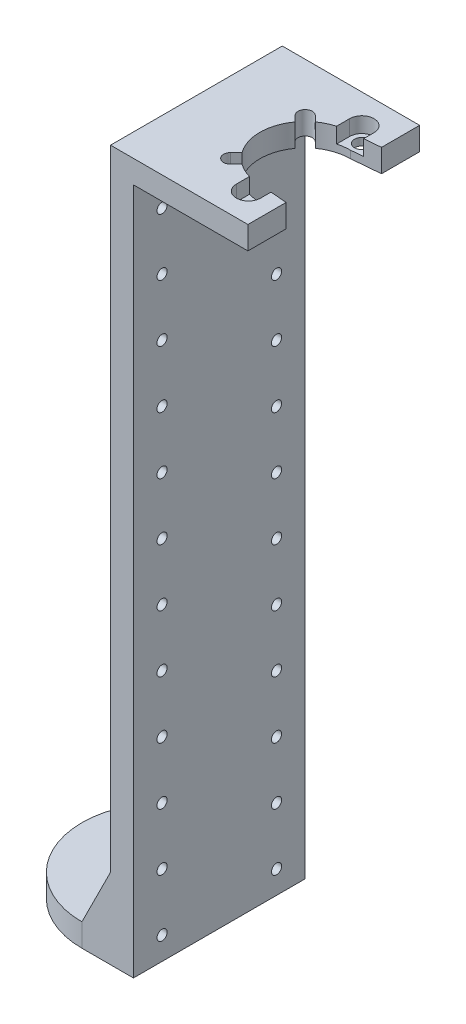
from build123d import *

# Parameters (mm, degrees)
BRACKETMAINBODY_DEPTH         = 15
CUTEXTRUDE_SQUIDCUTOUTS_START = 120
SQUIDCUTOUTS_R                = 1.3
CUTEXTRUDE_SQUIDCUTOUTS_DEPTH = 244.292335528
M4_CLEARANCE_HOLE1_D          = 4.5
CUT_EXTRUDE12_REACH           = 129.189
FILLET11_R                    = 15
FILLET12_R                    = 15
F_2_56_TAPPED_HOLE1_D         = 1.778
LPATTERN3_OUTLINE_R           = 0.889
LPATTERN3_DEPTH               = 4
CUT_EXTRUDE14_START           = -2.7
CUT_EXTRUDE14_OUTLINE_R       = 1.3
CUT_EXTRUDE14_DEPTH           = 2.7
BOSS_EXTRUDE3_DEPTH           = 2
BOSS_EXTRUDE4_DEPTH           = 2
FILLET17_R                    = 3.5
FILLET18_R                    = 3.5


# Read off the part's stored shape, not the designer's step: LPattern3, Cut-Extrude14
# Some blends are built 0.0001 mm under size
with BuildPart() as part:
    # Sketch1 → BracketMainBody (new, symmetric)
    with BuildSketch(Plane.XY):
        Polygon((0, 0), (0, 120), (24, 120), (24, 116), (4, 116), (4, -4), (-20, -4), (-20, 0), align=None)
    extrude(amount=BRACKETMAINBODY_DEPTH, both=True)

    # SQUIDcutouts → CutExtrude_SQUIDcutouts (cut, through all)
    with BuildSketch(Plane(origin=(0, 0, 0), x_dir=(1, 0, 0), z_dir=(0, 1, 0)).offset(CUTEXTRUDE_SQUIDCUTOUTS_START)):
        with Locations(Location((19, -9.9, 0), (0, 0, 270))):
            Circle(SQUIDCUTOUTS_R)
        with Locations(Location((19, 9.9, 0), (0, 0, 270))):
            Circle(SQUIDCUTOUTS_R)
        with BuildLine():
            Line((12.600343686, 4.631889361), (11.616116524, 5.616116524))
            ThreePointArc((11.616116524, 5.616116524), (11.616116524, 7.383883476), (13.383883476, 7.383883476))
            Line((13.383883476, 7.383883476), (14.368110639, 6.399656314))
            ThreePointArc((14.368110639, 6.399656314), (26.9, 0), (14.368110639, -6.399656314))
            Line((14.368110639, -6.399656314), (13.383883476, -7.383883476))
            ThreePointArc((13.383883476, -7.383883476), (11.616116524, -7.383883476), (11.616116524, -5.616116524))
            Line((11.616116524, -5.616116524), (12.600343686, -4.631889361))
            ThreePointArc((12.600343686, -4.631889361), (11.1, 0), (12.600343686, 4.631889361))
        make_face()
    extrude(amount=-CUTEXTRUDE_SQUIDCUTOUTS_DEPTH, mode=Mode.SUBTRACT)

    # M4 Clearance Hole1 (through all)
    with Locations(Plane(origin=(-10, -4, 0), x_dir=(-1, 0, 0), z_dir=(0, -1, 0))):
        with Locations((0, 0)):
            Hole(M4_CLEARANCE_HOLE1_D / 2)

    # champhers<2> → Cut-Extrude12 (cut, up to next)
    with BuildSketch(Plane(origin=(0, 120, 0), x_dir=(1, 0, 0), z_dir=(0, 1, 0)), mode=Mode.PRIVATE) as cut_extrude12_sk1:
        Polygon((24, 8.337443318), (24, 6.116371473), (19, 7.9), align=None)
    cut_extrude12_tool1 = extrude(cut_extrude12_sk1.sketch, amount=-CUT_EXTRUDE12_REACH, mode=Mode.PRIVATE) & part.part
    # champhers<2> → Cut-Extrude12 (cut, up to next)
    with BuildSketch(Plane(origin=(0, 120, 0), x_dir=(1, 0, 0), z_dir=(0, 1, 0)), mode=Mode.PRIVATE) as cut_extrude12_sk2:
        Polygon((24, -6.116371473), (19, -7.9), (24, -8.337443318), align=None)
    cut_extrude12_tool2 = extrude(cut_extrude12_sk2.sketch, amount=-CUT_EXTRUDE12_REACH, mode=Mode.PRIVATE) & part.part
    add(cut_extrude12_tool1.solids().sort_by_distance((22.333333, 120, -7.451272))[0], mode=Mode.SUBTRACT)
    add(cut_extrude12_tool2.solids().sort_by_distance((22.333333, 120, 7.451272))[0], mode=Mode.SUBTRACT)

    # Fillet11
    fillet11_edges = [part.edges().sort_by_distance(p)[0] for p in [
        (-20, -2, -15),
    ]]
    fillet(fillet11_edges, radius=FILLET11_R)

    # Fillet12
    fillet12_edges = [part.edges().sort_by_distance(p)[0] for p in [
        (-20, -2, 15),
    ]]
    fillet(fillet12_edges, radius=FILLET12_R - 0.0001)  # a hair under: the kernel refuses the full size

    # #2-56 Tapped Hole1 (through all)
    with Locations(Plane(origin=(0, 110, -10), x_dir=(0, 0, -1), z_dir=(-1, 0, 0))):
        with Locations((0, 0)):
            Hole(F_2_56_TAPPED_HOLE1_D / 2)

    # LPattern3 outline → LPattern3 (cut)
    with BuildSketch(Plane.YZ):
        with Locations((110, 10)):
            Circle(LPATTERN3_OUTLINE_R)
        with Locations((100, -10)):
            Circle(LPATTERN3_OUTLINE_R)
        with Locations((100, 10)):
            Circle(LPATTERN3_OUTLINE_R)
        with Locations((90, -10)):
            Circle(LPATTERN3_OUTLINE_R)
        with Locations((90, 10)):
            Circle(LPATTERN3_OUTLINE_R)
        with Locations((80, -10)):
            Circle(LPATTERN3_OUTLINE_R)
        with Locations((80, 10)):
            Circle(LPATTERN3_OUTLINE_R)
        with Locations((70, -10)):
            Circle(LPATTERN3_OUTLINE_R)
        with Locations((70, 10)):
            Circle(LPATTERN3_OUTLINE_R)
        with Locations((60, -10)):
            Circle(LPATTERN3_OUTLINE_R)
        with Locations((60, 10)):
            Circle(LPATTERN3_OUTLINE_R)
        with Locations((50, -10)):
            Circle(LPATTERN3_OUTLINE_R)
        with Locations((50, 10)):
            Circle(LPATTERN3_OUTLINE_R)
        with Locations((40, -10)):
            Circle(LPATTERN3_OUTLINE_R)
        with Locations((40, 10)):
            Circle(LPATTERN3_OUTLINE_R)
        with Locations((30, -10)):
            Circle(LPATTERN3_OUTLINE_R)
        with Locations((30, 10)):
            Circle(LPATTERN3_OUTLINE_R)
        with Locations((20, -10)):
            Circle(LPATTERN3_OUTLINE_R)
        with Locations((20, 10)):
            Circle(LPATTERN3_OUTLINE_R)
        with Locations((10, -10)):
            Circle(LPATTERN3_OUTLINE_R)
        with Locations((10, 10)):
            Circle(LPATTERN3_OUTLINE_R)
        with Locations((0, -10)):
            Circle(LPATTERN3_OUTLINE_R)
        with Locations((0, 10)):
            Circle(LPATTERN3_OUTLINE_R)
    extrude(amount=LPATTERN3_DEPTH, mode=Mode.SUBTRACT)

    # Cut-Extrude14 outline → Cut-Extrude14 (cut)
    # profile 1 of 2: a face of its own
    with BuildSketch(Plane(origin=(0, 120, 0), x_dir=(1, 0, 0), z_dir=(0, 1, 0)).offset(CUT_EXTRUDE14_START)):
        with BuildLine():
            Line((21.124094102, -9.9), (21.124094102, -8.085834154))
            Line((21.124094102, -8.085834154), (19, -7.9))
            ThreePointArc((19, -7.9), (17.928038551, -7.82693418), (16.875905898, -7.609088267))
            Line((16.875905898, -7.609088267), (16.875905898, -9.9))
            ThreePointArc((16.875905898, -9.9), (19, -12.024094102), (21.124094102, -9.9))
        make_face()
        with Locations((19, -9.9)):
            Circle(CUT_EXTRUDE14_OUTLINE_R, mode=Mode.SUBTRACT)
    # profile 2 of 2: a face of its own
    with BuildSketch(Plane(origin=(0, 120, 0), x_dir=(1, 0, 0), z_dir=(0, 1, 0)).offset(CUT_EXTRUDE14_START)):
        with BuildLine():
            Line((21.124094102, 8.085834154), (21.124094102, 9.9))
            ThreePointArc((21.124094102, 9.9), (19, 12.024094102), (16.875905898, 9.9))
            Line((16.875905898, 9.9), (16.875905898, 7.609088267))
            ThreePointArc((16.875905898, 7.609088267), (17.928038551, 7.82693418), (19, 7.9))
            Line((19, 7.9), (21.124094102, 8.085834154))
        make_face()
        with Locations((19, 9.9)):
            Circle(CUT_EXTRUDE14_OUTLINE_R, mode=Mode.SUBTRACT)
    extrude(amount=CUT_EXTRUDE14_DEPTH, mode=Mode.SUBTRACT)

    # Sketch30 → Boss-Extrude3 (add)
    with BuildSketch(Plane.XY.offset(15)):
        Polygon((-5, 0), (0, 0), (0, 10), align=None)
    extrude(amount=-BOSS_EXTRUDE3_DEPTH)

    # Sketch31 → Boss-Extrude4 (add)
    with BuildSketch(Plane(origin=(0, 0, -15), x_dir=(-1, 0, 0), z_dir=(0, 0, -1))):
        Polygon((0, 10), (0, 0), (5, 0), align=None)
    extrude(amount=-BOSS_EXTRUDE4_DEPTH)

    # Fillet17
    # the kernel refuses this fillet: 3.5 mm, written as the material it adds along each edge
    with BuildSketch(Plane(origin=(0, 0, -13), x_dir=(0, 0, 1), z_dir=(-1, 0, 0))) as fillet17_piece_1_section:
        with BuildLine():
            CenterArc((FILLET17_R, FILLET17_R), FILLET17_R, 180, 90)
            Line((0, FILLET17_R), (0, 0))
            Line((0, 0), (FILLET17_R, 0))
        make_face()
    fillet17_piece_1 = extrude(amount=13.75, mode=Mode.PRIVATE)
    fillet17_piece_1 = split(fillet17_piece_1, bisect_by=Plane(origin=(-4.463461732, 1.073076536, -10.533039881), z_dir=(0.894427190999916, -0.44721359549995787, 0)), keep=Keep.TOP, mode=Mode.PRIVATE)
    add(fillet17_piece_1)

    # Fillet18
    # the kernel refuses this fillet: 3.5 mm, written as the material it adds along each edge
    with BuildSketch(Plane(origin=(-13.75, 0, 13), x_dir=(0, 1, 0), z_dir=(1, 0, 0))) as fillet18_piece_1_section:
        with BuildLine():
            CenterArc((FILLET18_R, -FILLET18_R), FILLET18_R, 90, 90)
            Line((0, -FILLET18_R), (0, 0))
            Line((0, 0), (FILLET18_R, 0))
        make_face()
    fillet18_piece_1 = extrude(amount=13.75, mode=Mode.PRIVATE)
    fillet18_piece_1 = split(fillet18_piece_1, bisect_by=Plane(origin=(-4.153126037, 1.693747927, 12.281398302), z_dir=(0.894427190999916, -0.447213595499958, 0)), keep=Keep.TOP, mode=Mode.PRIVATE)
    add(fillet18_piece_1)


solid = part.part
